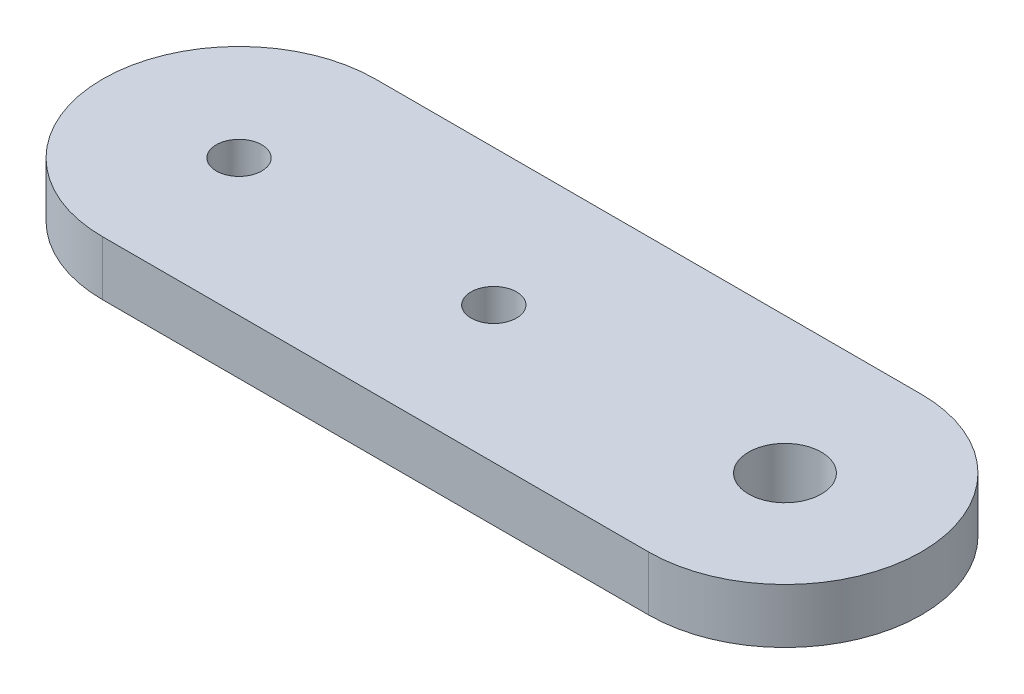
from build123d import *

# Parameters (mm, degrees)
SKETCH1_R           = 2
SKETCH1_R_2         = 1.25
BOSS_EXTRUDE1_DEPTH = 3


with BuildPart() as part:
    # Sketch1 → Boss-Extrude1 (new body)
    with BuildSketch(Plane(origin=(0, 0, 0), x_dir=(1, 0, 0), z_dir=(0, 1, 0))):
        with BuildLine():
            Line((0, 7.5), (30, 7.5))
            ThreePointArc((30, 7.5), (37.5, 0), (30, -7.5))
            Line((30, -7.5), (0, -7.5))
            ThreePointArc((0, -7.5), (-7.5, 0), (0, 7.5))
        make_face()
        with Locations((30, 0)):
            Circle(SKETCH1_R, mode=Mode.SUBTRACT)
        Circle(SKETCH1_R_2, mode=Mode.SUBTRACT)
        with Locations((14, 0)):
            Circle(SKETCH1_R_2, mode=Mode.SUBTRACT)
    extrude(amount=BOSS_EXTRUDE1_DEPTH)


solid = part.part
